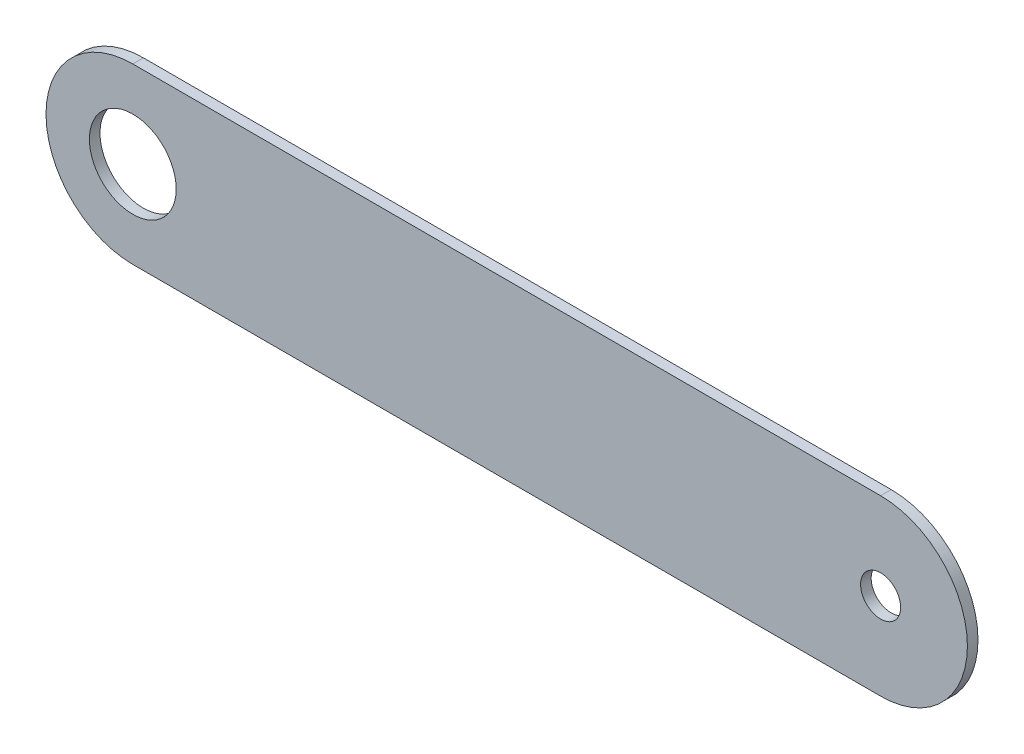
from build123d import *

# Parameters (mm, degrees)
SKETCH1_R           = 6.5
SKETCH1_R_2         = 3
BOSS_EXTRUDE1_DEPTH = 1.5875


with BuildPart() as part:
    # Sketch1 → Boss-Extrude1 (new body)
    with BuildSketch(Plane.XY):
        with BuildLine():
            Line((0, 13), (112, 13))
            ThreePointArc((112, 13), (125, 0), (112, -13))
            Line((112, -13), (0, -13))
            ThreePointArc((0, -13), (-13, 0), (0, 13))
        make_face()
        Circle(SKETCH1_R, mode=Mode.SUBTRACT)
        with Locations((112, 0)):
            Circle(SKETCH1_R_2, mode=Mode.SUBTRACT)
    extrude(amount=BOSS_EXTRUDE1_DEPTH)


solid = part.part
